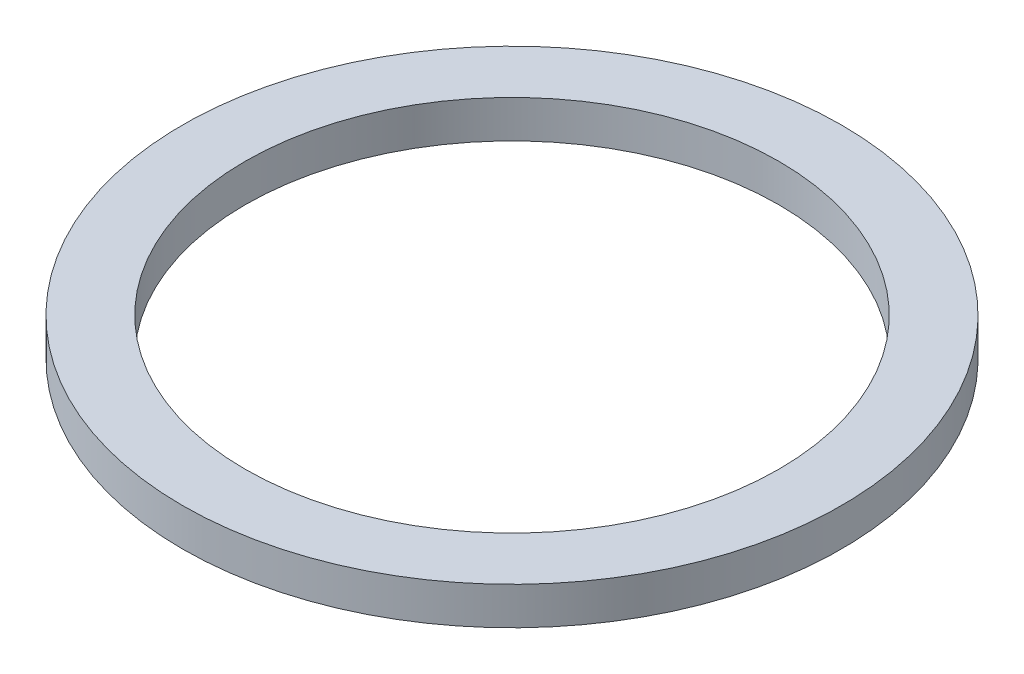
from build123d import *

# Parameters (mm, degrees)
SKETCH1_R           = 52.5
BOSS_EXTRUDE1_DEPTH = 6
SKETCH2_R           = 42.5
CUT_EXTRUDE1_DEPTH  = 75.488254108


with BuildPart() as part:
    # Sketch1 → Boss-Extrude1 (new body)
    with BuildSketch(Plane(origin=(0, 0, 0), x_dir=(1, 0, 0), z_dir=(0, 1, 0))):
        Circle(SKETCH1_R)
    extrude(amount=BOSS_EXTRUDE1_DEPTH)

    # Sketch2 → Cut-Extrude1 (cut, through all)
    with BuildSketch(Plane(origin=(0, 0, 0), x_dir=(1, 0, 0), z_dir=(0, 1, 0))):
        Circle(SKETCH2_R)
    extrude(amount=CUT_EXTRUDE1_DEPTH, mode=Mode.SUBTRACT)


solid = part.part
